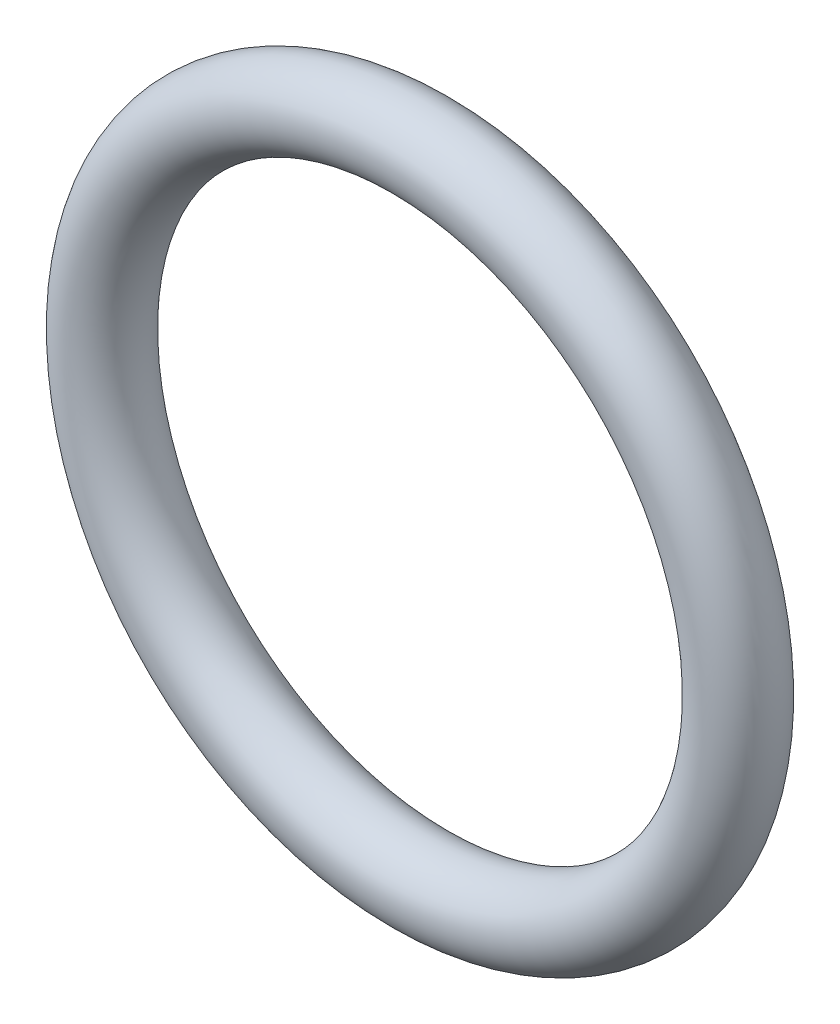
from build123d import *

# Parameters (mm, degrees)
SKETCH2_R = 1.7653


with BuildPart() as part:
    # Sweep2: sweep along a path in Sketch3
    with BuildLine(Plane.XY) as sweep2_path:
        CenterArc((0, 0), 14.2621, 0, 360)
    # Sketch2 → Sweep2 (sweep)
    with BuildSketch(Plane(origin=(0, 0, 0), x_dir=(0, 0, -1), z_dir=(1, 0, 0))):
        with Locations((0, 14.2621)):
            Circle(SKETCH2_R)
    sweep(path=sweep2_path.line)


solid = part.part
